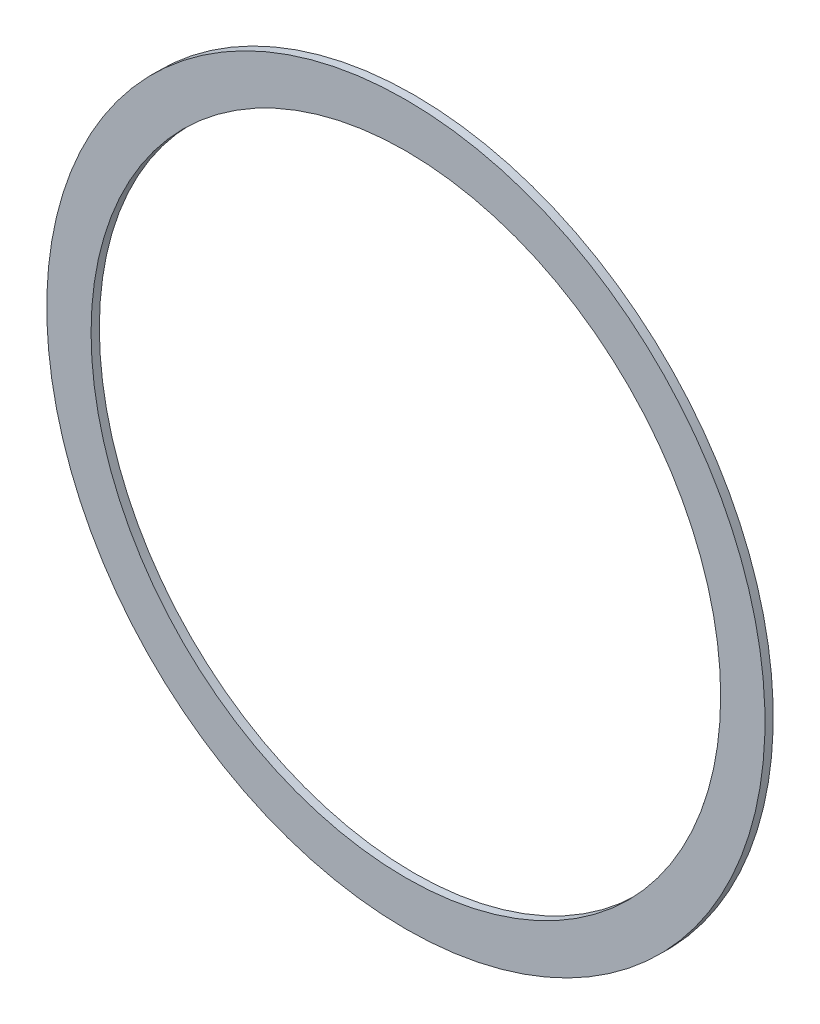
from build123d import *

# Parameters (mm, degrees)
SKETCH2_R           = 137.922
SKETCH2_R_2         = 120.904
BOSS_EXTRUDE2_DEPTH = 1.5875


with BuildPart() as part:
    # Sketch2 → Boss-Extrude2 (new, symmetric)
    with BuildSketch(Plane(origin=(248.273568551, -245.01347209, 0), x_dir=(0, -1, 0), z_dir=(0, 0, -1))):
        with Locations((-257.71347209, 248.273568551)):
            Circle(SKETCH2_R)
        with Locations((-257.71347209, 248.273568551)):
            Circle(SKETCH2_R_2, mode=Mode.SUBTRACT)
    extrude(amount=BOSS_EXTRUDE2_DEPTH, both=True)


solid = part.part
